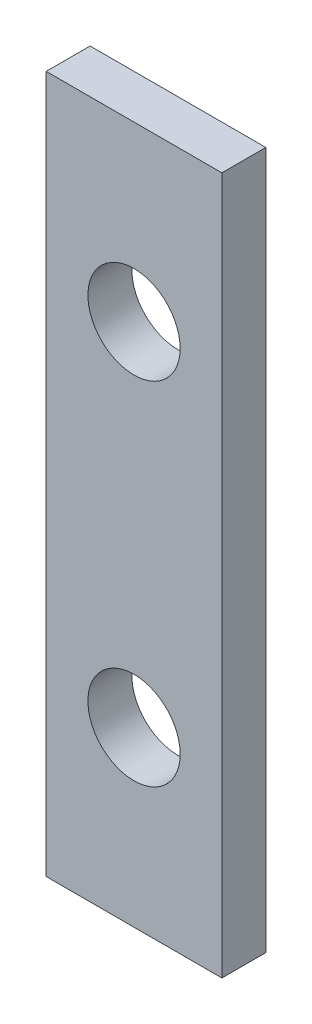
from build123d import *

# Parameters (mm, degrees)
SKETCH3_W           = 8
SKETCH3_H           = 2
BOSS_EXTRUDE2_DEPTH = 31.75
SKETCH4_R           = 2.1
CUT_EXTRUDE1_DEPTH  = 33.427248272


with BuildPart() as part:
    # Sketch3 → Boss-Extrude2 (new body)
    with BuildSketch(Plane(origin=(0, 0, 0), x_dir=(1, 0, 0), z_dir=(0, 1, 0))):
        with Locations((2.282032354, 3.507256135)):
            Rectangle(SKETCH3_W, SKETCH3_H)
    extrude(amount=BOSS_EXTRUDE2_DEPTH)

    # Sketch4 → Cut-Extrude1 (cut, through all)
    with BuildSketch(Plane.XY.offset(-2.507256135)):
        with Locations((2.282032354, 7.875)):
            Circle(SKETCH4_R)
        with Locations((2.282032354, 23.875)):
            Circle(SKETCH4_R)
    extrude(amount=-CUT_EXTRUDE1_DEPTH, mode=Mode.SUBTRACT)


solid = part.part
